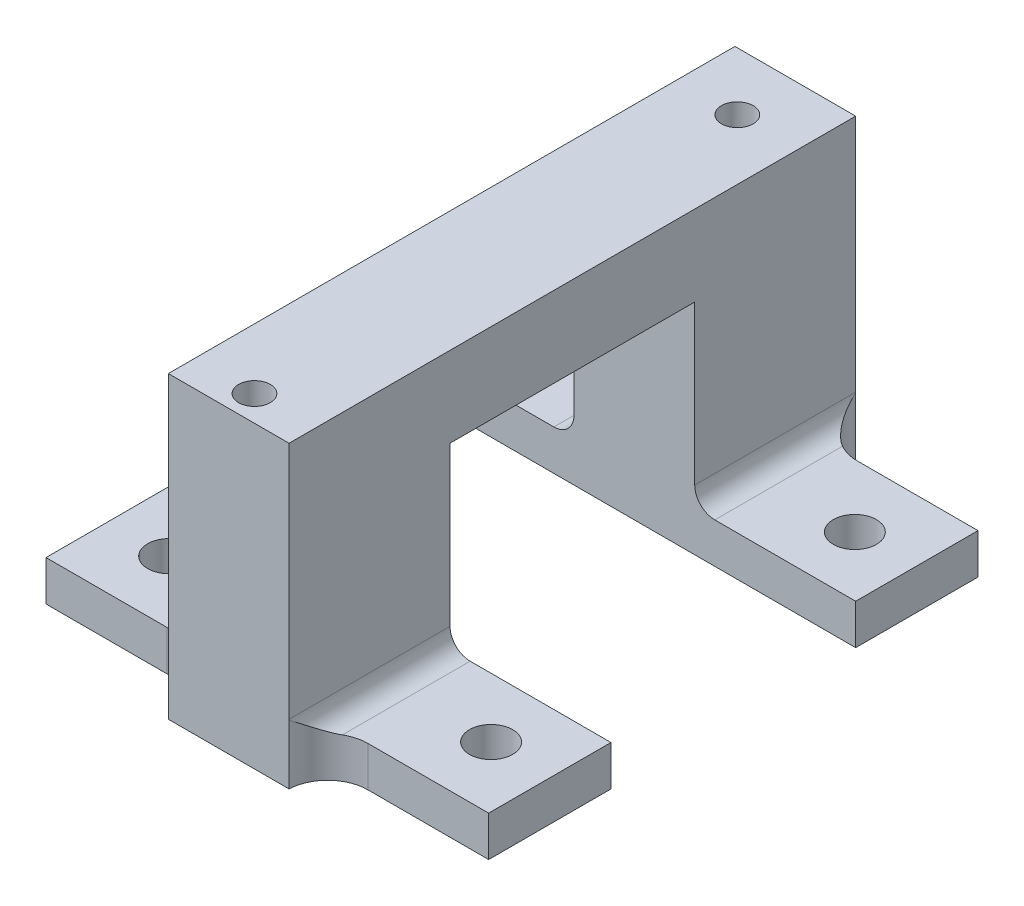
from build123d import *

# Parameters (mm, degrees)
BOSS_EXTRUDE1_DEPTH         = 4.7625
SKETCH4_W                   = 12.7
SKETCH4_H                   = 9.652
BOSS_EXTRUDE2_DEPTH         = 3.175
M3_CLEARANCE_HOLE1_D        = 3.4
MIRROR2_COPY_1_SKETCH_W     = 12.7
MIRROR2_COPY_1_SKETCH_H     = 9.652
MIRROR2_COPY_1_DEPTH        = 3.175
MIRROR2_COPY_2_D            = 3.4
FILLET1_R                   = 3.175
FILLET2_R                   = 1.5875
TAP_DRILL_FOR_M3X0_5_TAP1_D = 2.5


with BuildPart() as part:
    # Sketch2 → Boss-Extrude1 (new, symmetric)
    with BuildSketch(Plane(origin=(0, 0, 0), x_dir=(0, 0, -1), z_dir=(1, 0, 0))):
        Polygon((22.352, 23.622), (-22.352, 23.622), (-22.352, 0), (-9.652, 0), (-9.652, 17.272), (9.652, 17.272), (9.652, 0), (22.352, 0), align=None)
    extrude(amount=BOSS_EXTRUDE1_DEPTH, both=True)

    # Sketch4 → Boss-Extrude2 (add)
    with BuildSketch(Plane.XZ):
        with Locations((11.1125, 14.478)):
            Rectangle(SKETCH4_W, SKETCH4_H)
    boss_extrude2 = extrude(amount=-BOSS_EXTRUDE2_DEPTH)

    # M3 Clearance Hole1 (through all)
    with Locations(Plane(origin=(0, 3.175, 0), x_dir=(1, 0, 0), z_dir=(0, 1, 0))):
        with Locations((12.7, -14.351)):
            m3_clearance_hole1 = Hole(M3_CLEARANCE_HOLE1_D / 2)

    # Mirror1: Boss-Extrude2, M3 Clearance Hole1 across plane
    add(boss_extrude2.mirror(Plane.XY))
    add(m3_clearance_hole1.mirror(Plane.XY), mode=Mode.SUBTRACT)

    # Mirror2: Boss-Extrude2, M3 Clearance Hole1 across plane
    add(boss_extrude2.mirror(Plane(origin=(0, 0, 0), x_dir=(0, 0, 1), z_dir=(1, 0, 0))))
    add(m3_clearance_hole1.mirror(Plane(origin=(0, 0, 0), x_dir=(0, 0, 1), z_dir=(1, 0, 0))), mode=Mode.SUBTRACT)

    # Mirror2 copy 1 sketch → Mirror2 copy 1 (add)
    with BuildSketch(Plane(origin=(0, 0, 0), x_dir=(-1, 0, 0), z_dir=(0, -1, 0))):
        with Locations((11.1125, 14.478)):
            Rectangle(MIRROR2_COPY_1_SKETCH_W, MIRROR2_COPY_1_SKETCH_H)
    extrude(amount=-MIRROR2_COPY_1_DEPTH)

    # Mirror2 copy 2 (through all)
    with Locations(Plane(origin=(0, 3.175, 0), x_dir=(-1, 0, 0), z_dir=(0, 1, 0))):
        with Locations((12.7, -14.351)):
            Hole(MIRROR2_COPY_2_D / 2)

    # Fillet1
    # the kernel refuses this fillet: 3.175 mm, written as the material it adds along each edge
    with BuildSketch(Plane(origin=(-4.7625, 0, -19.304), x_dir=(0, 0, -1), z_dir=(0, 1, 0)), Plane(origin=(4.7625, 0, 19.304), x_dir=(0, 0, 1), z_dir=(0, 1, 0))) as fillet1_piece_1:
        with BuildLine():
            CenterArc((3.175, 3.172458983), FILLET1_R, 180, 87.707557224)
            Line((0, 3.172458983), (-0.0635, 3.172458983))
            Line((-0.0635, 3.172458983), (-0.0635, 0))
            Line((-0.0635, 0), (0, -0.0635))
            ThreePointArc((0, -0.0635), (1.524, -0.0635), (3.04546, -0.06344918))
            Line((3.04546, -0.06344918), (3.048, 0))
        make_face()
    extrude(amount=3.175)
    with BuildSketch(Plane(origin=(4.7625, 0, -19.304), x_dir=(0, 0, -1), z_dir=(0, 1, 0)), Plane(origin=(-4.7625, 0, 19.304), x_dir=(0, 0, 1), z_dir=(0, 1, 0))) as fillet1_piece_2:
        with BuildLine():
            CenterArc((3.175, -3.172458983), FILLET1_R, 92.292442776, 87.707557224)
            Line((0, -3.172458983), (-0.0635, -3.172458983))
            Line((-0.0635, -3.172458983), (-0.0635, 0))
            Line((-0.0635, 0), (0, 0.0635))
            ThreePointArc((0, 0.0635), (1.524, 0.0635), (3.04546, 0.06344918))
            Line((3.04546, 0.06344918), (3.048, 0))
        make_face()
    extrude(amount=3.175)

    # Fillet2
    # the kernel refuses this fillet: 1.5875 mm, written as the material it adds along each edge
    with BuildSketch(Plane(origin=(4.7625, 3.175, 22.352), x_dir=(1, 0, 0), z_dir=(0, 0, -1))) as fillet2_piece_1_section:
        with BuildLine():
            CenterArc((FILLET2_R, -FILLET2_R), FILLET2_R, 90, 90)
            Line((0, -FILLET2_R), (0, 0))
            Line((0, 0), (FILLET2_R, 0))
        make_face()
    fillet2_piece_1 = extrude(amount=12.7, mode=Mode.PRIVATE)
    fillet2_piece_1 = fillet2_piece_1 - Plane(origin=(7.934958983, 3.539048881, 22.479), x_dir=(0, 0, 1), z_dir=(0, -1, 0)) * Cylinder(3.175, 32, mode=Mode.PRIVATE)
    add(fillet2_piece_1)
    with BuildSketch(Plane(origin=(4.7625, 3.175, -22.352), x_dir=(1, 0, 0), z_dir=(0, 0, 1))) as fillet2_piece_2_section:
        with BuildLine():
            CenterArc((FILLET2_R, FILLET2_R), FILLET2_R, 180, 90)
            Line((0, FILLET2_R), (0, 0))
            Line((0, 0), (FILLET2_R, 0))
        make_face()
    fillet2_piece_2 = extrude(amount=12.7, mode=Mode.PRIVATE)
    fillet2_piece_2 = fillet2_piece_2 - Plane(origin=(7.934958983, 3.539054825, -22.479), x_dir=(0, 0, -1), z_dir=(0, -1, 0)) * Cylinder(3.175, 32, mode=Mode.PRIVATE)
    add(fillet2_piece_2)
    with BuildSketch(Plane(origin=(-4.7625, 3.175, 9.652), x_dir=(0, 1, 0), z_dir=(0, 0, 1))) as fillet2_piece_3_section:
        with BuildLine():
            CenterArc((FILLET2_R, FILLET2_R), FILLET2_R, 180, 90)
            Line((0, FILLET2_R), (0, 0))
            Line((0, 0), (FILLET2_R, 0))
        make_face()
    fillet2_piece_3 = extrude(amount=12.7, mode=Mode.PRIVATE)
    fillet2_piece_3 = fillet2_piece_3 - Plane(origin=(-7.934958983, 3.539056273, 22.479), x_dir=(0, 0, 1), z_dir=(0, -1, 0)) * Cylinder(3.175, 32, mode=Mode.PRIVATE)
    add(fillet2_piece_3)
    with BuildSketch(Plane(origin=(-4.7625, 3.175, -9.652), x_dir=(-1, 0, 0), z_dir=(0, 0, -1))) as fillet2_piece_4_section:
        with BuildLine():
            CenterArc((FILLET2_R, FILLET2_R), FILLET2_R, 180, 90)
            Line((0, FILLET2_R), (0, 0))
            Line((0, 0), (FILLET2_R, 0))
        make_face()
    fillet2_piece_4 = extrude(amount=12.7, mode=Mode.PRIVATE)
    fillet2_piece_4 = fillet2_piece_4 - Plane(origin=(-7.934958983, 3.539048881, -22.479), x_dir=(0, 0, -1), z_dir=(0, -1, 0)) * Cylinder(3.175, 32, mode=Mode.PRIVATE)
    add(fillet2_piece_4)

    # Tap Drill for M3x0.5 Tap1 (through all)
    with Locations(Plane(origin=(0, 23.622, 0), x_dir=(1, 0, 0), z_dir=(0, 1, 0))):
        with Locations((0, 17.778984556), (0, -20.321015444)):
            Hole(TAP_DRILL_FOR_M3X0_5_TAP1_D / 2)


solid = part.part
